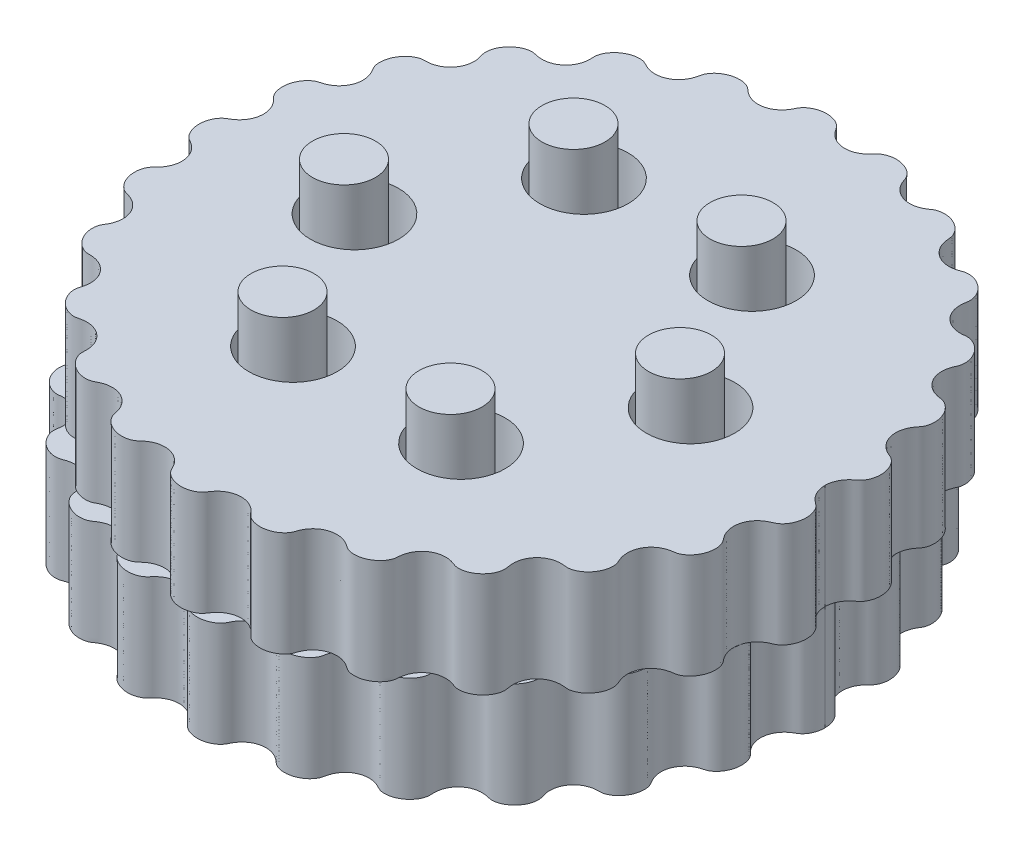
from build123d import *

# Parameters (mm, degrees)
ROTOR1_DEPTH               = 5
ROTOR2_DEPTH               = 5
SKETCH5_R                  = 2.1
CUT_EXTRUDE1_DEPTH         = 23.948222495
SKETCH7_R                  = 2.1
CUT_EXTRUDE2_DEPTH         = 23.948222495
BOSS_EXTRUDE3_DEPTH        = 7
BOSS_EXTRUDE3_DEPTH_BACK   = 7
SKETCH8_R                  = 1.5
BOSS_EXTRUDE3_2_DEPTH      = 7
BOSS_EXTRUDE3_2_DEPTH_BACK = 7
BOSS_EXTRUDE3_3_DEPTH      = 7
BOSS_EXTRUDE3_3_DEPTH_BACK = 7
BOSS_EXTRUDE3_4_DEPTH      = 7
BOSS_EXTRUDE3_4_DEPTH_BACK = 7
BOSS_EXTRUDE3_5_DEPTH      = 7
BOSS_EXTRUDE3_5_DEPTH_BACK = 7
BOSS_EXTRUDE3_6_DEPTH      = 7
BOSS_EXTRUDE3_6_DEPTH_BACK = 7


with BuildPart() as part:
    # Sketch1 → Rotor1 (new body)
    with BuildSketch(Plane(origin=(0, 0, 0), x_dir=(1, 0, 0), z_dir=(0, 1, 0))):
        with BuildLine():
            add(Edge.make_bspline(
                [(14.4, -1.1e-08), (14.400000001, -0.017963894), (14.400999325, -0.054155771), (14.405496286, -0.123245553), (14.417452599, -0.20573374), (14.435300787, -0.284760877), (14.4589362, -0.363829831), (14.495530719, -0.460103308), (14.553831752, -0.577672691), (14.628963281, -0.690475207), (14.720523729, -0.795156225), (14.809877934, -0.878529691), (14.885972394, -0.939710303), (14.965266307, -0.996877199), (15.039390332, -1.060755702), (15.101813087, -1.1365269), (15.154322639, -1.219306585), (15.208602434, -1.32923281), (15.256294513, -1.468797209), (15.288097057, -1.638083718), (15.294503414, -1.881017912), (15.252298042, -2.119867931), (15.163760173, -2.344380178), (15.042398535, -2.523140054), (14.942454381, -2.628650556), (14.845312007, -2.703603753), (14.757199453, -2.750371149), (14.66440863, -2.786732337), (14.573413204, -2.826965826), (14.463621968, -2.885730191), (14.308968592, -2.990239537), (14.130503911, -3.165844741), (13.972147716, -3.434992926), (13.893985816, -3.773342001), (13.916927808, -4.080338891), (13.995171309, -4.310200424), (14.082412472, -4.468541992), (14.150259613, -4.567703681), (14.210025969, -4.642870287), (14.270573808, -4.717649143), (14.32017647, -4.800200546), (14.365416943, -4.91091898), (14.399338621, -5.049561586), (14.416852384, -5.262398451), (14.384340257, -5.500937495), (14.304056201, -5.7310234), (14.177986314, -5.9417817), (14.047854527, -6.095731642), (13.910789322, -6.208565641), (13.777136929, -6.28441621), (13.654566558, -6.32593374), (13.550560114, -6.341335339), (13.446683831, -6.355615283), (13.344146077, -6.378219323), (13.218558991, -6.41641264), (13.049118162, -6.490187812), (12.850381416, -6.623876974), (12.649361866, -6.848376669), (12.506075586, -7.152262001), (12.462998655, -7.451002994), (12.489972163, -7.69205841), (12.539204894, -7.862350541), (12.580286881, -7.968000454), (12.618270058, -8.05035281), (12.654435707, -8.133644569), (12.67828402, -8.221362481), (12.69293821, -8.335981034), (12.690655932, -8.476153303), (12.654303427, -8.685493391), (12.545224093, -8.951238995), (12.373057296, -9.183722748), (12.149188736, -9.36630462), (11.953264421, -9.463318217), (11.8115865, -9.50624133), (11.686731815, -9.522483861), (11.58348893, -9.51696876), (11.48115852, -9.503432832), (11.378198871, -9.496859089), (11.274929425, -9.498212488), (11.172138668, -9.508022516), (11.008490166, -9.538189717), (10.791018295, -9.615836382), (10.543765179, -9.778692266), (10.347434116, -10.024278337), (10.240209477, -10.26860741), (10.194325995, -10.484243669), (10.185347958, -10.638429719), (10.193136925, -10.770510303), (10.209146495, -10.879533526), (10.225593522, -10.966240323), (10.235972752, -11.053921889), (10.233096637, -11.142311607), (10.215769105, -11.253426257), (10.176716121, -11.384209778), (10.088557605, -11.571773087), (9.914555383, -11.800570763), (9.643929342, -12.015790447), (9.338394122, -12.131431635), (9.092328696, -12.151919702), (8.938831739, -12.124722497), (8.874148218, -12.104917702), (8.823297107, -12.086266814), (8.760022097, -12.062210535), (8.657742826, -12.026792701), (8.51270891, -11.991319783), (8.29542858, -11.971044795), (8.023342439, -12.005783654), (7.739745801, -12.120021465), (7.477486439, -12.330308782), (7.309271559, -12.57578625), (7.227745922, -12.796401994), (7.194847937, -12.964652405), (7.183073646, -13.07292309), (7.177410404, -13.159952295), (7.163856376, -13.268191841), (7.12074447, -13.396146666), (7.04321196, -13.535732382), (6.89627577, -13.715388868), (6.667818125, -13.896296536), (6.347779256, -14.038713443), (6.019985381, -14.072734153), (5.761855417, -14.026890176), (5.598538329, -13.943823739), (5.512636752, -13.880075487), (5.401773469, -13.805681452), (5.259871996, -13.730304634), (5.052431683, -13.656485775), (4.773827305, -13.622953687), (4.46255928, -13.668320782), (4.188839227, -13.799904644), (3.99115524, -13.966548431), (3.857834156, -14.133926056), (3.782595533, -14.263163453), (3.73089554, -14.379947148), (3.695923656, -14.480038165), (3.668903575, -14.56056126), (3.62507674, -14.657311096), (3.549396273, -14.764707443), (3.439982877, -14.875186912), (3.255657935, -15.00602338), (2.992827005, -15.120144401), (2.65146927, -15.175703985), (2.340640845, -15.129056629), (2.125825026, -15.033765606), (2.01095249, -14.946775166), (1.969759765, -14.909017829), (1.931739421, -14.868053089), (1.895416305, -14.825543555), (1.849863454, -14.77258461), (1.77347621, -14.69102442), (1.657607631, -14.589330165), (1.467716596, -14.468702735), (1.201270643, -14.374830021), (0.894276464, -14.351781734), (0.570473057, -14.423577184), (0.317305808, -14.563244657), (0.151544535, -14.714094634), (0.048135537, -14.841768922), (-0.011407191, -14.928873374), (-0.056990802, -15.000049905), (-0.120513174, -15.084517519), (-0.216680297, -15.171117797), (-0.34549143, -15.252082711), (-0.54837758, -15.335584829), (-0.812768135, -15.385413023), (-1.08398033, -15.372591601), (-1.344979396, -15.297228844), (-1.543453254, -15.192188591), (-1.665764515, -15.097631883), (-1.754670111, -15.002005217), (-1.811224291, -14.912766064), (-1.84828467, -14.836853427), (-1.894839843, -14.742230931), (-1.981132624, -14.596441274), (-2.130461194, -14.415292399), (-2.371747297, -14.237403554), (-2.694146309, -14.124304399), (-3.005807455, -14.112082948), (-3.279802462, -14.174238248), (-3.481365688, -14.271328999), (-3.60773786, -14.358112928), (-3.692850373, -14.429558259), (-3.74427353, -14.476277738), (-3.785484156, -14.513603407), (-3.839036845, -14.557816708), (-3.971847627, -14.642561642), (-4.20921174, -14.716336781), (-4.537869776, -14.723206433), (-4.870972811, -14.623310282), (-5.119164279, -14.474114092), (-5.287202463, -14.31612828), (-5.381818938, -14.188749792), (-5.441586375, -14.068625268), (-5.46975415, -13.963937183), (-5.486204905, -13.878819004), (-5.510615327, -13.773376574), (-5.562785616, -13.611202262), (-5.668639833, -13.402851094), (-5.861501447, -13.180791), (-6.140857637, -13.003605734), (-6.432388767, -12.920479541), (-6.707046809, -12.913935909), (-6.924587142, -12.957968989), (-7.07050238, -13.011926964), (-7.171892452, -13.061227322), (-7.234172284, -13.094294359), (-7.284238063, -13.120336712), (-7.348454275, -13.149383063), (-7.450392674, -13.181305856), (-7.592859889, -13.199325129), (-7.822504161, -13.187514007), (-8.108178972, -13.101882305), (-8.360699787, -12.94808201), (-8.564054354, -12.739257859), (-8.686860146, -12.541025873), (-8.74585884, -12.391334007), (-8.771139209, -12.257945407), (-8.769723405, -12.148158808), (-8.76448864, -12.060600001), (-8.76328367, -11.951025213), (-8.773134312, -11.82121231), (-8.80185927, -11.673189798), (-8.872937495, -11.471740575), (-9.004528382, -11.249998927), (-9.220498075, -11.035106921), (-9.499737861, -10.890462164), (-9.747533575, -10.836885182), (-9.938296039, -10.832213385), (-10.067515159, -10.843724441), (-10.169837402, -10.860857799), (-10.270401277, -10.885915811), (-10.371724825, -10.908895631), (-10.499540752, -10.914403334), (-10.649899337, -10.893032288), (-10.864421966, -10.823595689), (-11.115446859, -10.670179726), (-11.318488225, -10.460805422), (-11.461426574, -10.211875584), (-11.524752828, -10.01339185), (-11.546391783, -9.877677893), (-11.548709946, -9.764594057), (-11.539339964, -9.676135035), (-11.516898431, -9.590207141), (-11.489593176, -9.505764669), (-11.460576483, -9.39879123), (-11.437115987, -9.267755201), (-11.428038548, -9.112624279), (-11.448899374, -8.891732592), (-11.525306454, -8.644379141), (-11.680559893, -8.391694512), (-11.908335055, -8.1892927), (-12.146089604, -8.066431986), (-12.351540814, -8.011178606), (-12.509041199, -7.991839863), (-12.640826604, -7.989460905), (-12.746563923, -7.988166594), (-12.874375664, -7.963828284), (-13.017764419, -7.905880158), (-13.169249054, -7.811412184), (-13.319017911, -7.67467483), (-13.471981566, -7.480515093), (-13.581458721, -7.26088384), (-13.644013329, -7.026575527), (-13.652860983, -6.812940158), (-13.636539268, -6.672850547), (-13.606445611, -6.560514458), (-13.570431248, -6.47644639), (-13.523166045, -6.398237921), (-13.475169498, -6.320638215), (-13.421523123, -6.219949083), (-13.352206533, -6.055609876), (-13.297223226, -5.817805919), (-13.306144027, -5.511232057), (-13.418270878, -5.185792715), (-13.599550751, -4.937285866), (-13.788421733, -4.782570887), (-13.950444377, -4.693122875), (-14.06801063, -4.644081777), (-14.164678268, -4.612081771), (-14.263358787, -4.586968674), (-14.360622663, -4.556204), (-14.472064557, -4.497213616), (-14.590574842, -4.40538808), (-14.741515667, -4.240877039), (-14.885567754, -3.984040211), (-14.960547294, -3.700013764), (-14.962476998, -3.409357191), (-14.917122591, -3.199365314), (-14.864866179, -3.065550719), (-14.804762459, -2.961268161), (-14.743749576, -2.885986018), (-14.673498586, -2.819366418), (-14.604759941, -2.751454392), (-14.541077466, -2.678635477), (-14.482882337, -2.601336735), (-14.398435049, -2.468448884), (-14.309915908, -2.267781913), (-14.257239562, -1.991630404), (-14.294765453, -1.652711362), (-14.415656628, -1.372497371), (-14.564768485, -1.180602711), (-14.700945682, -1.058517568), (-14.801501658, -0.985661301), (-14.885953438, -0.933566063), (-14.97324049, -0.886147055), (-15.055953156, -0.830915631), (-15.145345985, -0.745702812), (-15.234104562, -0.627876898), (-15.302099632, -0.497917175), (-15.350570864, -0.359469707), (-15.378415705, -0.242180773), (-15.393222629, -0.147288369), (-15.398767774, -0.063519122), (-15.399999999, -0.02121356), (-15.4, -1.249e-06)],
                knots=[0.062565796, 0.062565796, 0.062565796, 0.062565796, 0.062565796, 0.063859973, 0.06515415, 0.066448326, 0.067742503, 0.06903668, 0.070330857, 0.07291921, 0.075992333, 0.077528894, 0.079065456, 0.080602017, 0.082138578, 0.08367514, 0.085211701, 0.086753761, 0.088295822, 0.091379943, 0.094464064, 0.097548185, 0.103528845, 0.106519174, 0.109509504, 0.111075374, 0.112641243, 0.114207112, 0.115772981, 0.117338851, 0.11890472, 0.122036458, 0.127492162, 0.132947866, 0.138255082, 0.143562297, 0.146585003, 0.148096356, 0.149607709, 0.151119061, 0.152630414, 0.154141767, 0.15565312, 0.158617995, 0.161582869, 0.167512619, 0.170668106, 0.173823593, 0.17697908, 0.180134567, 0.181785014, 0.183435461, 0.185085908, 0.186736355, 0.188386802, 0.190037249, 0.193338142, 0.198333612, 0.203329082, 0.208757311, 0.21418554, 0.217038738, 0.218465337, 0.219891935, 0.221318534, 0.222745133, 0.224171732, 0.225598331, 0.22856804, 0.23153775, 0.237477169, 0.243508984, 0.246524892, 0.2495408, 0.251163787, 0.252786774, 0.254409762, 0.256032749, 0.257655736, 0.259278723, 0.26090171, 0.262524697, 0.268116353, 0.273708009, 0.279232337, 0.2819945, 0.284756664, 0.287531357, 0.288918704, 0.290306051, 0.291693397, 0.293080744, 0.294468091, 0.295855437, 0.298751953, 0.301648468, 0.307441499, 0.313806246, 0.320170993, 0.321874543, 0.322726318, 0.323578093, 0.324429868, 0.325281643, 0.326985192, 0.330392292, 0.333799391, 0.338941908, 0.344084424, 0.349371027, 0.354657629, 0.357399899, 0.358771034, 0.360142168, 0.361513303, 0.362884438, 0.365626708, 0.368571539, 0.37151637, 0.377406032, 0.383827609, 0.390249186, 0.391929851, 0.393610516, 0.39529118, 0.396971845, 0.400333174, 0.403694503, 0.409075747, 0.41445699, 0.419832854, 0.422520785, 0.425208717, 0.427878342, 0.429213155, 0.430547968, 0.431882781, 0.433217593, 0.435887219, 0.438758038, 0.441628857, 0.447370496, 0.453780785, 0.460191075, 0.461070296, 0.461949517, 0.462828738, 0.463707959, 0.46458718, 0.465466401, 0.467224842, 0.470741726, 0.47425861, 0.479541903, 0.484825197, 0.489835983, 0.494846769, 0.497503724, 0.498832202, 0.500160679, 0.501489157, 0.502817634, 0.505474589, 0.508247059, 0.511019529, 0.516564468, 0.52227034, 0.525123276, 0.527976212, 0.530631288, 0.531958826, 0.533286364, 0.534613902, 0.53594144, 0.538596516, 0.543936045, 0.549275574, 0.554531257, 0.559786941, 0.563284399, 0.566781857, 0.568530587, 0.569404951, 0.570279316, 0.57115368, 0.572028045, 0.573776774, 0.580152949, 0.586529123, 0.592383377, 0.595310504, 0.598237631, 0.600962992, 0.602325673, 0.603688354, 0.605051034, 0.606413715, 0.609139076, 0.614392618, 0.619646159, 0.624660447, 0.629674735, 0.633223523, 0.636772312, 0.638546707, 0.639433904, 0.640321101, 0.641208298, 0.642095495, 0.64386989, 0.647025799, 0.650181709, 0.656493529, 0.662419511, 0.665382503, 0.668345494, 0.671104535, 0.672484055, 0.673863575, 0.675243096, 0.676622616, 0.679381657, 0.682041398, 0.68470114, 0.690020622, 0.695473381, 0.700926139, 0.704188253, 0.70581931, 0.707450368, 0.709081425, 0.710712482, 0.712343539, 0.713974596, 0.717095441, 0.720216286, 0.726457975, 0.732286917, 0.735201388, 0.738115858, 0.739511278, 0.740906697, 0.742302116, 0.743697535, 0.745092954, 0.746488373, 0.749279211, 0.752059022, 0.754838832, 0.760398454, 0.765423781, 0.770449108, 0.773768675, 0.777088241, 0.778748025, 0.780407808, 0.782067591, 0.783727374, 0.786901153, 0.790074931, 0.793248709, 0.796422487, 0.802397424, 0.805384893, 0.808372361, 0.809807963, 0.811243566, 0.812679168, 0.81411477, 0.815550372, 0.816985974, 0.819857178, 0.825317904, 0.830778629, 0.835989797, 0.841200965, 0.844404173, 0.846005778, 0.847607382, 0.849208986, 0.85081059, 0.852412194, 0.854013798, 0.857107086, 0.860200373, 0.866386948, 0.872352981, 0.875335998, 0.878319014, 0.879839881, 0.881360748, 0.882881615, 0.884402482, 0.885923349, 0.887444216, 0.888965083, 0.890485949, 0.895823145, 0.90116034, 0.906397405, 0.911634469, 0.914757263, 0.91631866, 0.917880057, 0.919441454, 0.921002851, 0.922564248, 0.924125645, 0.927182053, 0.930238461, 0.931766665, 0.933294869, 0.934823073, 0.936351301, 0.936351301, 0.936351301, 0.936351301, 0.936351301], degree=4))
            add(Edge.make_bspline(
                [(14.4, -1.1e-08), (14.4, 0.017963987), (14.400999323, 0.054155864), (14.405496281, 0.123245646), (14.417452591, 0.205733834), (14.435300775, 0.284760971), (14.458936185, 0.363829927), (14.4955307, 0.460103405), (14.553831728, 0.577672791), (14.628963253, 0.690475309), (14.720523696, 0.795156331), (14.809877897, 0.878529801), (14.885972355, 0.939710416), (14.965266265, 0.996877315), (15.039390288, 1.060755822), (15.10181304, 1.136527022), (15.154322588, 1.219306709), (15.208602379, 1.329232937), (15.256294452, 1.468797337), (15.288096989, 1.638083848), (15.294503336, 1.881018042), (15.252297954, 2.119868059), (15.163760076, 2.344380303), (15.042398431, 2.523140174), (14.942454271, 2.628650672), (14.845311894, 2.703603864), (14.757199339, 2.750371256), (14.664408514, 2.786732441), (14.573413087, 2.826965926), (14.463621848, 2.885730286), (14.308968467, 2.990239626), (14.130503779, 3.165844823), (13.972147573, 3.434993001), (13.893985659, 3.773342073), (13.916927638, 4.080338964), (13.99517113, 4.310200501), (14.082412286, 4.468542072), (14.150259423, 4.567703763), (14.210025776, 4.642870373), (14.270573611, 4.71764923), (14.32017627, 4.800200636), (14.365416739, 4.910919071), (14.399338411, 5.049561679), (14.416852165, 5.262398545), (14.384340028, 5.500937587), (14.304055963, 5.731023489), (14.177986067, 5.941781784), (14.047854273, 6.09573172), (13.910789064, 6.208565714), (13.777136668, 6.284416277), (13.654566295, 6.325933802), (13.550559851, 6.341335397), (13.446683566, 6.355615337), (13.344145812, 6.378219372), (13.218558725, 6.416412684), (13.049117892, 6.490187849), (12.850381141, 6.623877003), (12.649361581, 6.84837669), (12.506075288, 7.152262016), (12.462998345, 7.451003007), (12.489971843, 7.692058424), (12.539204567, 7.862350557), (12.58028655, 7.968000472), (12.618269724, 8.050352829), (12.654435369, 8.13364459), (12.678283679, 8.221362503), (12.692937864, 8.335981056), (12.690655579, 8.476153325), (12.654303066, 8.685493412), (12.545223721, 8.951239011), (12.373056915, 9.183722757), (12.149188347, 9.36630462), (11.953264028, 9.463318208), (11.811586105, 9.506241315), (11.68673142, 9.522483842), (11.583488535, 9.516968736), (11.481158125, 9.503432803), (11.378198476, 9.496859057), (11.27492903, 9.498212452), (11.172138272, 9.508022475), (11.00848977, 9.538189669), (10.791017895, 9.615836325), (10.543764772, 9.778692199), (10.347433699, 10.024278261), (10.24020905, 10.26860733), (10.194325559, 10.484243587), (10.185347516, 10.638429637), (10.193136478, 10.770510221), (10.209146043, 10.879533445), (10.225593066, 10.966240242), (10.235972292, 11.053921809), (10.233096174, 11.142311527), (10.215768637, 11.253426176), (10.176715648, 11.384209695), (10.088557124, 11.571773001), (9.914554892, 11.800570669), (9.643928842, 12.015790342), (9.338393618, 12.131431518), (9.092328191, 12.151919575), (8.938831235, 12.124722364), (8.874147714, 12.104917565), (8.823296604, 12.086266676), (8.760021595, 12.062210394), (8.657742326, 12.026792556), (8.512708411, 11.991319631), (8.295428082, 11.971044634), (8.02334194, 12.005783482), (7.739745297, 12.120021281), (7.477485926, 12.330308588), (7.309271036, 12.575786049), (7.227745391, 12.796401789), (7.194847398, 12.964652198), (7.183073102, 13.072922883), (7.177409857, 13.159952088), (7.163855825, 13.268191633), (7.120743913, 13.396146456), (7.043211398, 13.535732169), (6.8962752, 13.715388649), (6.667817547, 13.896296307), (6.347778672, 14.038713201), (6.019984796, 14.072733898), (5.761854834, 14.02688991), (5.59853775, 13.943823467), (5.512636175, 13.88007521), (5.401772895, 13.805681171), (5.259871426, 13.730304348), (5.052431116, 13.656485479), (4.773826739, 13.62295338), (4.462558712, 13.668320463), (4.188838653, 13.799904313), (3.991154659, 13.966548092), (3.857833569, 14.133925711), (3.78259494, 14.263163104), (3.730894943, 14.379946797), (3.695923054, 14.480037814), (3.66890297, 14.560560907), (3.625076131, 14.657310741), (3.549395659, 14.764707085), (3.439982259, 14.87518655), (3.255657311, 15.00602301), (2.992826376, 15.12014402), (2.651468639, 15.175703589), (2.340640217, 15.129056221), (2.125824401, 15.033765188), (2.010951868, 14.946774745), (1.969759145, 14.909017405), (1.931738803, 14.868052664), (1.895415689, 14.825543128), (1.84986284, 14.772584182), (1.773475599, 14.691023988), (1.657607025, 14.589329728), (1.467715995, 14.468702291), (1.201270045, 14.374829566), (0.894275868, 14.351781266), (0.570472458, 14.423576702), (0.317305203, 14.563244165), (0.151543923, 14.714094135), (0.04813492, 14.841768418), (-0.011407811, 14.928872868), (-0.056991425, 15.000049398), (-0.120513801, 15.084517008), (-0.216680927, 15.171117283), (-0.345492063, 15.252082191), (-0.548378217, 15.335584301), (-0.812768774, 15.385412484), (-1.083980969, 15.372591051), (-1.344980032, 15.297228283), (-1.543453885, 15.192188022), (-1.665765143, 15.097631308), (-1.754670735, 15.002004639), (-1.81122491, 14.912765484), (-1.848285287, 14.836852845), (-1.894840456, 14.742230347), (-1.98113323, 14.596440686), (-2.130461793, 14.415291805), (-2.371747889, 14.23740295), (-2.694146896, 14.124303782), (-3.005808041, 14.112082318), (-3.279803051, 14.174237606), (-3.481366281, 14.271328349), (-3.607738457, 14.358112273), (-3.692850973, 14.4295576), (-3.744274132, 14.476277077), (-3.785484759, 14.513602744), (-3.83903745, 14.557816043), (-3.971848236, 14.642560972), (-4.209212351, 14.716336101), (-4.537870388, 14.723205739), (-4.870973419, 14.623309574), (-5.11916488, 14.474113373), (-5.287203058, 14.316127554), (-5.381819528, 14.188749063), (-5.44158696, 14.068624536), (-5.46975473, 13.96393645), (-5.486205481, 13.878818271), (-5.510615899, 13.773375839), (-5.562786182, 13.611201525), (-5.66864039, 13.402850352), (-5.861501995, 13.18079025), (-6.140858177, 13.003604973), (-6.432389304, 12.920478768), (-6.707047346, 12.913935125), (-6.924587681, 12.957968196), (-7.070502921, 13.011926165), (-7.171892995, 13.061226518), (-7.234172828, 13.094293553), (-7.284238608, 13.120335903), (-7.348454821, 13.149382252), (-7.450393222, 13.181305041), (-7.592860438, 13.199324308), (-7.822504709, 13.187513176), (-8.108179517, 13.101881463), (-8.360700325, 12.948081157), (-8.564054883, 12.739256997), (-8.686860667, 12.541025006), (-8.745859355, 12.391333138), (-8.771139719, 12.257944537), (-8.76972391, 12.148157938), (-8.764489142, 12.060599131), (-8.763284167, 11.951024344), (-8.773134803, 11.82121144), (-8.801859755, 11.673188927), (-8.872937972, 11.4717397), (-9.004528849, 11.249998047), (-9.220498534, 11.035106033), (-9.499738314, 10.890461263), (-9.747534026, 10.836884271), (-9.93829649, 10.832212466), (-10.067515609, 10.843723517), (-10.169837853, 10.860856871), (-10.27040173, 10.885914879), (-10.371725278, 10.908894695), (-10.499541206, 10.914402392), (-10.649899789, 10.89303134), (-10.864422416, 10.823594732), (-11.115447303, 10.670178758), (-11.31848866, 10.460804446), (-11.461426998, 10.211874603), (-11.524753245, 10.013390865), (-11.546392194, 9.877676908), (-11.548710352, 9.764593071), (-11.539340366, 9.67613405), (-11.516898829, 9.590206157), (-11.489593571, 9.505763686), (-11.460576873, 9.398790248), (-11.437116372, 9.26775422), (-11.428038926, 9.112623299), (-11.448899743, 8.891731611), (-11.525306813, 8.644378157), (-11.680560241, 8.391693521), (-11.908335396, 8.1892917), (-12.146089939, 8.066430976), (-12.351541147, 8.011177587), (-12.509041531, 7.991838838), (-12.640826936, 7.989459874), (-12.746564255, 7.988165559), (-12.874375995, 7.963827243), (-13.017764748, 7.905879111), (-13.169249379, 7.811411131), (-13.319018229, 7.674673771), (-13.471981877, 7.480514028), (-13.581459023, 7.26088277), (-13.644013621, 7.026574455), (-13.652861266, 6.812939085), (-13.636539546, 6.672849474), (-13.606445884, 6.560513387), (-13.570431517, 6.47644532), (-13.523166311, 6.398236853), (-13.47516976, 6.320637149), (-13.421523381, 6.21994802), (-13.352206784, 6.055608816), (-13.297223468, 5.817804861), (-13.306144256, 5.511230999), (-13.418271093, 5.185791652), (-13.599550957, 4.937284795), (-13.788421932, 4.782569808), (-13.950444572, 4.69312179), (-14.068010823, 4.644080687), (-14.16467846, 4.612080677), (-14.263358978, 4.586967575), (-14.360622852, 4.556202898), (-14.472064743, 4.497212509), (-14.590575025, 4.405386968), (-14.741515844, 4.240875921), (-14.885567919, 3.984039087), (-14.960547448, 3.700012637), (-14.96247714, 3.409356064), (-14.917122724, 3.199364189), (-14.864866306, 3.065549595), (-14.804762583, 2.96126704), (-14.743749696, 2.8859849), (-14.673498703, 2.819365303), (-14.604760055, 2.751453279), (-14.541077577, 2.678634367), (-14.482882445, 2.601335627), (-14.398435152, 2.46844778), (-14.309916002, 2.267780812), (-14.257239645, 1.991629306), (-14.294765521, 1.652710263), (-14.415656685, 1.372496266), (-14.564768534, 1.1806016), (-14.700945726, 1.058516451), (-14.801501699, 0.985660181), (-14.885953477, 0.933564939), (-14.973240527, 0.886145928), (-15.055953191, 0.8309145), (-15.145346016, 0.745701677), (-15.234104589, 0.62787576), (-15.302099652, 0.497916033), (-15.350570879, 0.359468564), (-15.378415715, 0.242179629), (-15.393222635, 0.147287224), (-15.398767777, 0.063517977), (-15.4, 0.021212414), (-15.4, -1.249e-06)],
                knots=[0.062565796, 0.062565796, 0.062565796, 0.062565796, 0.062565796, 0.063859973, 0.06515415, 0.066448326, 0.067742503, 0.06903668, 0.070330857, 0.07291921, 0.075992333, 0.077528894, 0.079065456, 0.080602017, 0.082138578, 0.08367514, 0.085211701, 0.086753761, 0.088295822, 0.091379943, 0.094464064, 0.097548185, 0.103528845, 0.106519174, 0.109509504, 0.111075374, 0.112641243, 0.114207112, 0.115772981, 0.117338851, 0.11890472, 0.122036458, 0.127492162, 0.132947866, 0.138255082, 0.143562297, 0.146585003, 0.148096356, 0.149607709, 0.151119061, 0.152630414, 0.154141767, 0.15565312, 0.158617995, 0.161582869, 0.167512619, 0.170668106, 0.173823593, 0.17697908, 0.180134567, 0.181785014, 0.183435461, 0.185085908, 0.186736355, 0.188386802, 0.190037249, 0.193338142, 0.198333612, 0.203329082, 0.208757311, 0.21418554, 0.217038738, 0.218465337, 0.219891935, 0.221318534, 0.222745133, 0.224171732, 0.225598331, 0.22856804, 0.23153775, 0.237477169, 0.243508984, 0.246524892, 0.2495408, 0.251163787, 0.252786774, 0.254409762, 0.256032749, 0.257655736, 0.259278723, 0.26090171, 0.262524697, 0.268116353, 0.273708009, 0.279232337, 0.2819945, 0.284756664, 0.287531357, 0.288918704, 0.290306051, 0.291693397, 0.293080744, 0.294468091, 0.295855437, 0.298751953, 0.301648468, 0.307441499, 0.313806246, 0.320170993, 0.321874543, 0.322726318, 0.323578093, 0.324429868, 0.325281643, 0.326985192, 0.330392292, 0.333799391, 0.338941908, 0.344084424, 0.349371027, 0.354657629, 0.357399899, 0.358771034, 0.360142168, 0.361513303, 0.362884438, 0.365626708, 0.368571539, 0.37151637, 0.377406032, 0.383827609, 0.390249186, 0.391929851, 0.393610516, 0.39529118, 0.396971845, 0.400333174, 0.403694503, 0.409075747, 0.41445699, 0.419832854, 0.422520785, 0.425208717, 0.427878342, 0.429213155, 0.430547968, 0.431882781, 0.433217593, 0.435887219, 0.438758038, 0.441628857, 0.447370496, 0.453780785, 0.460191075, 0.461070296, 0.461949517, 0.462828738, 0.463707959, 0.46458718, 0.465466401, 0.467224842, 0.470741726, 0.47425861, 0.479541903, 0.484825197, 0.489835983, 0.494846769, 0.497503724, 0.498832202, 0.500160679, 0.501489157, 0.502817634, 0.505474589, 0.508247059, 0.511019529, 0.516564468, 0.52227034, 0.525123276, 0.527976212, 0.530631288, 0.531958826, 0.533286364, 0.534613902, 0.53594144, 0.538596516, 0.543936045, 0.549275574, 0.554531257, 0.559786941, 0.563284399, 0.566781857, 0.568530587, 0.569404951, 0.570279316, 0.57115368, 0.572028045, 0.573776774, 0.580152949, 0.586529123, 0.592383377, 0.595310504, 0.598237631, 0.600962992, 0.602325673, 0.603688354, 0.605051034, 0.606413715, 0.609139076, 0.614392618, 0.619646159, 0.624660447, 0.629674735, 0.633223523, 0.636772312, 0.638546707, 0.639433904, 0.640321101, 0.641208298, 0.642095495, 0.64386989, 0.647025799, 0.650181709, 0.656493529, 0.662419511, 0.665382503, 0.668345494, 0.671104535, 0.672484055, 0.673863575, 0.675243096, 0.676622616, 0.679381657, 0.682041398, 0.68470114, 0.690020622, 0.695473381, 0.700926139, 0.704188253, 0.70581931, 0.707450368, 0.709081425, 0.710712482, 0.712343539, 0.713974596, 0.717095441, 0.720216286, 0.726457975, 0.732286917, 0.735201388, 0.738115858, 0.739511278, 0.740906697, 0.742302116, 0.743697535, 0.745092954, 0.746488373, 0.749279211, 0.752059022, 0.754838832, 0.760398454, 0.765423781, 0.770449108, 0.773768675, 0.777088241, 0.778748025, 0.780407808, 0.782067591, 0.783727374, 0.786901153, 0.790074931, 0.793248709, 0.796422487, 0.802397424, 0.805384893, 0.808372361, 0.809807963, 0.811243566, 0.812679168, 0.81411477, 0.815550372, 0.816985974, 0.819857178, 0.825317904, 0.830778629, 0.835989797, 0.841200965, 0.844404173, 0.846005778, 0.847607382, 0.849208986, 0.85081059, 0.852412194, 0.854013798, 0.857107086, 0.860200373, 0.866386948, 0.872352981, 0.875335998, 0.878319014, 0.879839881, 0.881360748, 0.882881615, 0.884402482, 0.885923349, 0.887444216, 0.888965083, 0.890485949, 0.895823145, 0.90116034, 0.906397405, 0.911634469, 0.914757263, 0.91631866, 0.917880057, 0.919441454, 0.921002851, 0.922564248, 0.924125645, 0.927182053, 0.930238461, 0.931766665, 0.933294869, 0.934823073, 0.936351277, 0.936351277, 0.936351277, 0.936351277, 0.936351277], degree=4))
        make_face()
    extrude(amount=ROTOR1_DEPTH)

    # Sketch3 → Rotor2 (add)
    with BuildSketch(Plane(origin=(0, 0, 0), x_dir=(1, 0, 0), z_dir=(0, 1, 0))):
        with BuildLine():
            add(Edge.make_bspline(
                [(-15.4, -5e-09), (-15.4, -0.017963888), (-15.400999323, -0.054155765), (-15.405496281, -0.123245547), (-15.417452591, -0.205733735), (-15.435300776, -0.284760873), (-15.458936185, -0.363829828), (-15.4955307, -0.460103306), (-15.553831728, -0.577672692), (-15.628963253, -0.69047521), (-15.720523696, -0.795156232), (-15.809877897, -0.878529703), (-15.885972355, -0.939710317), (-15.965266265, -0.996877217), (-16.039390288, -1.060755723), (-16.10181304, -1.136526924), (-16.154322588, -1.219306611), (-16.208602379, -1.329232838), (-16.256294452, -1.468797238), (-16.288096989, -1.638083749), (-16.294503336, -1.881017943), (-16.252297954, -2.119867961), (-16.163760076, -2.344380204), (-16.042398431, -2.523140075), (-15.942454271, -2.628650573), (-15.845311894, -2.703603766), (-15.757199339, -2.750371158), (-15.664408514, -2.786732343), (-15.573413087, -2.826965828), (-15.463621848, -2.885730188), (-15.308968468, -2.990239528), (-15.130503779, -3.165844724), (-14.972147574, -3.434992903), (-14.893985659, -3.773341974), (-14.916927638, -4.080338866), (-14.99517113, -4.310200402), (-15.082412287, -4.468541973), (-15.150259423, -4.567703664), (-15.210025776, -4.642870274), (-15.270573612, -4.717649132), (-15.32017627, -4.800200537), (-15.365416739, -4.910918973), (-15.399338412, -5.04956158), (-15.416852165, -5.262398446), (-15.384340028, -5.500937488), (-15.304055963, -5.73102339), (-15.177986067, -5.941781686), (-15.047854273, -6.095731621), (-14.910789064, -6.208565615), (-14.777136668, -6.284416179), (-14.654566295, -6.325933703), (-14.550559851, -6.341335298), (-14.446683567, -6.355615238), (-14.344145812, -6.378219273), (-14.218558725, -6.416412585), (-14.049117893, -6.49018775), (-13.850381141, -6.623876904), (-13.649361581, -6.848376591), (-13.506075289, -7.152261917), (-13.462998345, -7.451002908), (-13.489971843, -7.692058325), (-13.539204567, -7.862350458), (-13.58028655, -7.968000373), (-13.618269724, -8.05035273), (-13.654435369, -8.133644491), (-13.678283679, -8.221362404), (-13.692937864, -8.335980957), (-13.690655579, -8.476153226), (-13.654303066, -8.685493313), (-13.545223721, -8.951238912), (-13.373056915, -9.183722658), (-13.149188347, -9.366304521), (-12.953264028, -9.463318109), (-12.811586105, -9.506241216), (-12.68673142, -9.522483743), (-12.583488535, -9.516968637), (-12.481158125, -9.503432705), (-12.378198476, -9.496858958), (-12.27492903, -9.498212353), (-12.172138273, -9.508022377), (-12.00848977, -9.53818957), (-11.791017895, -9.615836226), (-11.543764772, -9.7786921), (-11.347433699, -10.024278163), (-11.24020905, -10.268607231), (-11.19432556, -10.484243488), (-11.185347516, -10.638429538), (-11.193136478, -10.770510123), (-11.209146043, -10.879533346), (-11.225593066, -10.966240143), (-11.235972293, -11.05392171), (-11.233096174, -11.142311428), (-11.215768637, -11.253426077), (-11.176715648, -11.384209597), (-11.088557124, -11.571772902), (-10.914554892, -11.80057057), (-10.643928842, -12.015790244), (-10.338393618, -12.131431419), (-10.092328192, -12.151919476), (-9.938831235, -12.124722265), (-9.874147715, -12.104917467), (-9.823296604, -12.086266577), (-9.760021595, -12.062210295), (-9.657742326, -12.026792457), (-9.512708412, -11.991319533), (-9.295428082, -11.971044536), (-9.02334194, -12.005783383), (-8.739745297, -12.120021182), (-8.477485926, -12.330308489), (-8.309271036, -12.57578595), (-8.227745391, -12.79640169), (-8.194847398, -12.964652099), (-8.183073102, -13.072922784), (-8.177409858, -13.159951989), (-8.163855825, -13.268191535), (-8.120743914, -13.396146358), (-8.043211398, -13.53573207), (-7.896275201, -13.71538855), (-7.667817547, -13.896296209), (-7.347778673, -14.038713103), (-7.019984797, -14.072733799), (-6.761854834, -14.026889811), (-6.59853775, -13.943823368), (-6.512636175, -13.880075112), (-6.401772895, -13.805681073), (-6.259871426, -13.730304249), (-6.052431116, -13.65648538), (-5.773826739, -13.622953281), (-5.462558712, -13.668320364), (-5.188838654, -13.799904214), (-4.991154659, -13.966547993), (-4.857833569, -14.133925612), (-4.782594941, -14.263163006), (-4.730894943, -14.379946699), (-4.695923054, -14.480037715), (-4.66890297, -14.560560808), (-4.625076131, -14.657310643), (-4.54939566, -14.764706987), (-4.439982259, -14.875186451), (-4.255657312, -15.006022911), (-3.992826377, -15.120143921), (-3.651468639, -15.175703491), (-3.340640217, -15.129056122), (-3.125824401, -15.03376509), (-3.010951868, -14.946774646), (-2.969759145, -14.909017307), (-2.931738803, -14.868052565), (-2.895415689, -14.825543029), (-2.84986284, -14.772584083), (-2.7734756, -14.691023889), (-2.657607025, -14.58932963), (-2.467715995, -14.468702192), (-2.201270046, -14.374829467), (-1.894275868, -14.351781167), (-1.570472458, -14.423576604), (-1.317305203, -14.563244066), (-1.151543923, -14.714094036), (-1.04813492, -14.84176832), (-0.988592189, -14.92887277), (-0.943008575, -15.000049299), (-0.879486199, -15.084516909), (-0.783319073, -15.171117184), (-0.654507937, -15.252082092), (-0.451621783, -15.335584202), (-0.187231226, -15.385412385), (0.083980968, -15.372590952), (0.344980032, -15.297228184), (0.543453885, -15.192187923), (0.665765143, -15.097631209), (0.754670734, -15.00200454), (0.81122491, -14.912765385), (0.848285287, -14.836852746), (0.894840455, -14.742230248), (0.98113323, -14.596440588), (1.130461793, -14.415291706), (1.371747889, -14.237402851), (1.694146895, -14.124303683), (2.005808041, -14.112082219), (2.279803051, -14.174237507), (2.481366281, -14.27132825), (2.607738457, -14.358112174), (2.692850973, -14.429557501), (2.744274132, -14.476276979), (2.785484759, -14.513602646), (2.83903745, -14.557815944), (2.971848236, -14.642560873), (3.209212351, -14.716336002), (3.537870388, -14.72320564), (3.870973419, -14.623309475), (4.11916488, -14.474113275), (4.287203057, -14.316127456), (4.381819528, -14.188748965), (4.44158696, -14.068624437), (4.46975473, -13.963936351), (4.486205481, -13.878818172), (4.510615899, -13.77337574), (4.562786182, -13.611201426), (4.66864039, -13.402850254), (4.861501994, -13.180790152), (5.140858177, -13.003604874), (5.432389304, -12.920478669), (5.707047345, -12.913935027), (5.924587681, -12.957968097), (6.070502921, -13.011926066), (6.171892994, -13.061226419), (6.234172828, -13.094293454), (6.284238608, -13.120335805), (6.348454821, -13.149382153), (6.450393222, -13.181304942), (6.592860438, -13.199324209), (6.822504709, -13.187513078), (7.108179517, -13.101881364), (7.360700325, -12.948081058), (7.564054883, -12.739256899), (7.686860667, -12.541024908), (7.745859355, -12.391333039), (7.771139719, -12.257944439), (7.769723909, -12.148157839), (7.764489141, -12.060599032), (7.763284167, -11.951024245), (7.773134803, -11.821211342), (7.801859755, -11.673188828), (7.872937972, -11.471739602), (8.004528849, -11.249997949), (8.220498534, -11.035105934), (8.499738314, -10.890461165), (8.747534026, -10.836884172), (8.938296489, -10.832212367), (9.067515609, -10.843723419), (9.169837853, -10.860856772), (9.270401729, -10.88591478), (9.371725278, -10.908894596), (9.499541205, -10.914402294), (9.649899789, -10.893031242), (9.864422416, -10.823594633), (10.115447302, -10.67017866), (10.318488659, -10.460804347), (10.461426998, -10.211874504), (10.524753244, -10.013390767), (10.546392194, -9.877676809), (10.548710352, -9.764592973), (10.539340366, -9.676133952), (10.516898829, -9.590206058), (10.489593571, -9.505763588), (10.460576873, -9.39879015), (10.437116372, -9.267754122), (10.428038926, -9.1126232), (10.448899743, -8.891731512), (10.525306813, -8.644378058), (10.680560241, -8.391693422), (10.908335396, -8.189291601), (11.146089939, -8.066430877), (11.351541147, -8.011177488), (11.509041531, -7.991838739), (11.640826936, -7.989459775), (11.746564255, -7.98816546), (11.874375994, -7.963827144), (12.017764748, -7.905879012), (12.169249379, -7.811411032), (12.319018229, -7.674673672), (12.471981877, -7.480513929), (12.581459023, -7.260882671), (12.644013621, -7.026574356), (12.652861266, -6.812938986), (12.636539545, -6.672849376), (12.606445883, -6.560513288), (12.570431517, -6.476445222), (12.523166311, -6.398236755), (12.47516976, -6.320637051), (12.421523381, -6.219947921), (12.352206784, -6.055608717), (12.297223468, -5.817804762), (12.306144256, -5.5112309), (12.418271093, -5.185791554), (12.599550957, -4.937284696), (12.788421932, -4.78256971), (12.950444572, -4.693121691), (13.068010823, -4.644080588), (13.16467846, -4.612080578), (13.263358977, -4.586967477), (13.360622852, -4.5562028), (13.472064743, -4.49721241), (13.590575025, -4.40538687), (13.741515844, -4.240875822), (13.885567919, -3.984038988), (13.960547448, -3.700012538), (13.96247714, -3.409355965), (13.917122724, -3.19936409), (13.864866306, -3.065549497), (13.804762582, -2.961266941), (13.743749695, -2.885984801), (13.673498703, -2.819365204), (13.604760055, -2.751453181), (13.541077577, -2.678634269), (13.482882445, -2.601335529), (13.398435152, -2.468447682), (13.309916002, -2.267780714), (13.257239645, -1.991629208), (13.294765521, -1.652710164), (13.415656685, -1.372496168), (13.564768534, -1.180601502), (13.700945726, -1.058516353), (13.801501699, -0.985660082), (13.885953477, -0.93356484), (13.973240527, -0.886145829), (14.05595319, -0.830914401), (14.145346016, -0.745701578), (14.234104588, -0.627875661), (14.302099652, -0.497915935), (14.350570879, -0.359468465), (14.378415715, -0.24217953), (14.393222635, -0.147287126), (14.398767776, -0.063517878), (14.4, -0.021212316), (14.4, -5e-09)],
                knots=[0.062565796, 0.062565796, 0.062565796, 0.062565796, 0.062565796, 0.063859973, 0.06515415, 0.066448326, 0.067742503, 0.06903668, 0.070330857, 0.07291921, 0.075992333, 0.077528894, 0.079065456, 0.080602017, 0.082138578, 0.08367514, 0.085211701, 0.086753761, 0.088295822, 0.091379943, 0.094464064, 0.097548185, 0.103528845, 0.106519174, 0.109509504, 0.111075374, 0.112641243, 0.114207112, 0.115772981, 0.117338851, 0.11890472, 0.122036458, 0.127492162, 0.132947866, 0.138255082, 0.143562297, 0.146585003, 0.148096356, 0.149607709, 0.151119061, 0.152630414, 0.154141767, 0.15565312, 0.158617995, 0.161582869, 0.167512619, 0.170668106, 0.173823593, 0.17697908, 0.180134567, 0.181785014, 0.183435461, 0.185085908, 0.186736355, 0.188386802, 0.190037249, 0.193338142, 0.198333612, 0.203329082, 0.208757311, 0.21418554, 0.217038738, 0.218465337, 0.219891935, 0.221318534, 0.222745133, 0.224171732, 0.225598331, 0.22856804, 0.23153775, 0.237477169, 0.243508984, 0.246524892, 0.2495408, 0.251163787, 0.252786774, 0.254409762, 0.256032749, 0.257655736, 0.259278723, 0.26090171, 0.262524697, 0.268116353, 0.273708009, 0.279232337, 0.2819945, 0.284756664, 0.287531357, 0.288918704, 0.290306051, 0.291693397, 0.293080744, 0.294468091, 0.295855437, 0.298751953, 0.301648468, 0.307441499, 0.313806246, 0.320170993, 0.321874543, 0.322726318, 0.323578093, 0.324429868, 0.325281643, 0.326985192, 0.330392292, 0.333799391, 0.338941908, 0.344084424, 0.349371027, 0.354657629, 0.357399899, 0.358771034, 0.360142168, 0.361513303, 0.362884438, 0.365626708, 0.368571539, 0.37151637, 0.377406032, 0.383827609, 0.390249186, 0.391929851, 0.393610516, 0.39529118, 0.396971845, 0.400333174, 0.403694503, 0.409075747, 0.41445699, 0.419832854, 0.422520785, 0.425208717, 0.427878342, 0.429213155, 0.430547968, 0.431882781, 0.433217593, 0.435887219, 0.438758038, 0.441628857, 0.447370496, 0.453780785, 0.460191075, 0.461070296, 0.461949517, 0.462828738, 0.463707959, 0.46458718, 0.465466401, 0.467224842, 0.470741726, 0.47425861, 0.479541903, 0.484825197, 0.489835983, 0.494846769, 0.497503724, 0.498832202, 0.500160679, 0.501489157, 0.502817634, 0.505474589, 0.508247059, 0.511019529, 0.516564468, 0.52227034, 0.525123276, 0.527976212, 0.530631288, 0.531958826, 0.533286364, 0.534613902, 0.53594144, 0.538596516, 0.543936045, 0.549275574, 0.554531257, 0.559786941, 0.563284399, 0.566781857, 0.568530587, 0.569404951, 0.570279316, 0.57115368, 0.572028045, 0.573776774, 0.580152949, 0.586529123, 0.592383377, 0.595310504, 0.598237631, 0.600962992, 0.602325673, 0.603688354, 0.605051034, 0.606413715, 0.609139076, 0.614392618, 0.619646159, 0.624660447, 0.629674735, 0.633223523, 0.636772312, 0.638546707, 0.639433904, 0.640321101, 0.641208298, 0.642095495, 0.64386989, 0.647025799, 0.650181709, 0.656493529, 0.662419511, 0.665382503, 0.668345494, 0.671104535, 0.672484055, 0.673863575, 0.675243096, 0.676622616, 0.679381657, 0.682041398, 0.68470114, 0.690020622, 0.695473381, 0.700926139, 0.704188253, 0.70581931, 0.707450368, 0.709081425, 0.710712482, 0.712343539, 0.713974596, 0.717095441, 0.720216286, 0.726457975, 0.732286917, 0.735201388, 0.738115858, 0.739511278, 0.740906697, 0.742302116, 0.743697535, 0.745092954, 0.746488373, 0.749279211, 0.752059022, 0.754838832, 0.760398454, 0.765423781, 0.770449108, 0.773768675, 0.777088241, 0.778748025, 0.780407808, 0.782067591, 0.783727374, 0.786901153, 0.790074931, 0.793248709, 0.796422487, 0.802397424, 0.805384893, 0.808372361, 0.809807963, 0.811243566, 0.812679168, 0.81411477, 0.815550372, 0.816985974, 0.819857178, 0.825317904, 0.830778629, 0.835989797, 0.841200965, 0.844404173, 0.846005778, 0.847607382, 0.849208986, 0.85081059, 0.852412194, 0.854013798, 0.857107086, 0.860200373, 0.866386948, 0.872352981, 0.875335998, 0.878319014, 0.879839881, 0.881360748, 0.882881615, 0.884402482, 0.885923349, 0.887444216, 0.888965083, 0.890485949, 0.895823145, 0.90116034, 0.906397405, 0.911634469, 0.914757263, 0.91631866, 0.917880057, 0.919441454, 0.921002851, 0.922564248, 0.924125645, 0.927182053, 0.930238461, 0.931766665, 0.933294869, 0.934823073, 0.936351277, 0.936351277, 0.936351277, 0.936351277, 0.936351277], degree=4))
            add(Edge.make_bspline(
                [(-15.4, -5e-09), (-15.4, 0.017963967), (-15.400999323, 0.054155844), (-15.405496281, 0.123245626), (-15.417452591, 0.205733814), (-15.435300776, 0.284760952), (-15.458936185, 0.363829907), (-15.4955307, 0.460103385), (-15.553831728, 0.577672771), (-15.628963253, 0.690475289), (-15.720523696, 0.795156311), (-15.809877897, 0.878529782), (-15.885972355, 0.939710396), (-15.965266265, 0.996877296), (-16.039390288, 1.060755802), (-16.10181304, 1.136527003), (-16.154322588, 1.21930669), (-16.208602379, 1.329232917), (-16.256294452, 1.468797317), (-16.288096989, 1.638083828), (-16.294503336, 1.881018022), (-16.252297954, 2.11986804), (-16.163760076, 2.344380283), (-16.042398431, 2.523140154), (-15.942454271, 2.628650652), (-15.845311894, 2.703603845), (-15.757199339, 2.750371237), (-15.664408514, 2.786732422), (-15.573413087, 2.826965907), (-15.463621848, 2.885730267), (-15.308968468, 2.990239607), (-15.130503779, 3.165844803), (-14.972147574, 3.434992982), (-14.893985659, 3.773342053), (-14.916927638, 4.080338945), (-14.99517113, 4.310200481), (-15.082412287, 4.468542052), (-15.150259423, 4.567703743), (-15.210025776, 4.642870353), (-15.270573612, 4.717649211), (-15.32017627, 4.800200616), (-15.365416739, 4.910919052), (-15.399338412, 5.049561659), (-15.416852165, 5.262398525), (-15.384340028, 5.500937567), (-15.304055963, 5.731023469), (-15.177986067, 5.941781765), (-15.047854273, 6.0957317), (-14.910789064, 6.208565694), (-14.777136668, 6.284416258), (-14.654566295, 6.325933782), (-14.550559851, 6.341335377), (-14.446683567, 6.355615317), (-14.344145812, 6.378219352), (-14.218558725, 6.416412664), (-14.049117893, 6.490187829), (-13.850381141, 6.623876983), (-13.649361581, 6.84837667), (-13.506075288, 7.152261996), (-13.462998345, 7.451002987), (-13.489971843, 7.692058404), (-13.539204567, 7.862350537), (-13.58028655, 7.968000452), (-13.618269724, 8.050352809), (-13.654435369, 8.13364457), (-13.678283679, 8.221362483), (-13.692937864, 8.335981036), (-13.690655579, 8.476153305), (-13.654303066, 8.685493392), (-13.545223721, 8.951238991), (-13.373056915, 9.183722737), (-13.149188347, 9.3663046), (-12.953264028, 9.463318188), (-12.811586105, 9.506241295), (-12.68673142, 9.522483822), (-12.583488535, 9.516968716), (-12.481158125, 9.503432784), (-12.378198476, 9.496859037), (-12.27492903, 9.498212432), (-12.172138273, 9.508022456), (-12.00848977, 9.538189649), (-11.791017895, 9.615836305), (-11.543764772, 9.778692179), (-11.347433699, 10.024278242), (-11.24020905, 10.26860731), (-11.19432556, 10.484243567), (-11.185347516, 10.638429617), (-11.193136478, 10.770510202), (-11.209146043, 10.879533425), (-11.225593066, 10.966240222), (-11.235972293, 11.053921789), (-11.233096174, 11.142311507), (-11.215768637, 11.253426156), (-11.176715648, 11.384209676), (-11.088557124, 11.571772981), (-10.914554892, 11.800570649), (-10.643928842, 12.015790323), (-10.338393618, 12.131431498), (-10.092328192, 12.151919555), (-9.938831235, 12.124722344), (-9.874147715, 12.104917546), (-9.823296604, 12.086266656), (-9.760021595, 12.062210374), (-9.657742326, 12.026792536), (-9.512708412, 11.991319612), (-9.295428082, 11.971044615), (-9.02334194, 12.005783462), (-8.739745297, 12.120021261), (-8.477485926, 12.330308568), (-8.309271036, 12.575786029), (-8.227745391, 12.796401769), (-8.194847398, 12.964652178), (-8.183073102, 13.072922863), (-8.177409857, 13.159952068), (-8.163855825, 13.268191614), (-8.120743913, 13.396146437), (-8.043211398, 13.535732149), (-7.8962752, 13.715388629), (-7.667817547, 13.896296288), (-7.347778673, 14.038713182), (-7.019984797, 14.072733878), (-6.761854834, 14.02688989), (-6.59853775, 13.943823447), (-6.512636175, 13.880075191), (-6.401772895, 13.805681152), (-6.259871426, 13.730304328), (-6.052431116, 13.656485459), (-5.773826739, 13.62295336), (-5.462558712, 13.668320443), (-5.188838654, 13.799904293), (-4.991154659, 13.966548072), (-4.857833569, 14.133925691), (-4.782594941, 14.263163085), (-4.730894943, 14.379946778), (-4.695923054, 14.480037794), (-4.66890297, 14.560560887), (-4.625076131, 14.657310722), (-4.54939566, 14.764707066), (-4.439982259, 14.87518653), (-4.255657312, 15.00602299), (-3.992826377, 15.120144), (-3.651468639, 15.17570357), (-3.340640217, 15.129056201), (-3.125824401, 15.033765169), (-3.010951868, 14.946774725), (-2.969759145, 14.909017386), (-2.931738803, 14.868052644), (-2.895415689, 14.825543108), (-2.84986284, 14.772584162), (-2.7734756, 14.691023968), (-2.657607025, 14.589329709), (-2.467715995, 14.468702271), (-2.201270046, 14.374829546), (-1.894275868, 14.351781246), (-1.570472458, 14.423576683), (-1.317305203, 14.563244145), (-1.151543923, 14.714094115), (-1.04813492, 14.841768399), (-0.988592189, 14.928872849), (-0.943008575, 15.000049378), (-0.879486199, 15.084516988), (-0.783319073, 15.171117263), (-0.654507937, 15.252082171), (-0.451621783, 15.335584281), (-0.187231226, 15.385412464), (0.083980968, 15.372591031), (0.344980032, 15.297228263), (0.543453885, 15.192188002), (0.665765143, 15.097631288), (0.754670734, 15.002004619), (0.81122491, 14.912765464), (0.848285287, 14.836852825), (0.894840455, 14.742230327), (0.98113323, 14.596440667), (1.130461793, 14.415291785), (1.371747889, 14.23740293), (1.694146896, 14.124303762), (2.005808041, 14.112082298), (2.279803051, 14.174237586), (2.481366281, 14.271328329), (2.607738457, 14.358112253), (2.692850973, 14.42955758), (2.744274132, 14.476277058), (2.785484759, 14.513602725), (2.83903745, 14.557816023), (2.971848236, 14.642560952), (3.209212351, 14.716336081), (3.537870388, 14.723205719), (3.870973419, 14.623309554), (4.11916488, 14.474113354), (4.287203058, 14.316127535), (4.381819528, 14.188749044), (4.44158696, 14.068624516), (4.46975473, 13.96393643), (4.486205481, 13.878818251), (4.510615899, 13.773375819), (4.562786182, 13.611201505), (4.66864039, 13.402850333), (4.861501994, 13.180790231), (5.140858177, 13.003604953), (5.432389304, 12.920478748), (5.707047345, 12.913935105), (5.924587681, 12.957968176), (6.070502921, 13.011926145), (6.171892994, 13.061226498), (6.234172828, 13.094293533), (6.284238608, 13.120335884), (6.348454821, 13.149382232), (6.450393222, 13.181305021), (6.592860438, 13.199324288), (6.822504709, 13.187513156), (7.108179517, 13.101881443), (7.360700325, 12.948081137), (7.564054883, 12.739256977), (7.686860667, 12.541024986), (7.745859355, 12.391333118), (7.771139719, 12.257944518), (7.76972391, 12.148157918), (7.764489142, 12.060599111), (7.763284167, 11.951024324), (7.773134803, 11.821211421), (7.801859755, 11.673188907), (7.872937972, 11.471739681), (8.004528849, 11.249998028), (8.220498534, 11.035106013), (8.499738314, 10.890461244), (8.747534026, 10.836884251), (8.938296489, 10.832212446), (9.067515609, 10.843723497), (9.169837853, 10.860856851), (9.27040173, 10.885914859), (9.371725278, 10.908894675), (9.499541205, 10.914402373), (9.649899789, 10.893031321), (9.864422416, 10.823594712), (10.115447302, 10.670178738), (10.318488659, 10.460804426), (10.461426998, 10.211874583), (10.524753244, 10.013390846), (10.546392194, 9.877676888), (10.548710352, 9.764593052), (10.539340366, 9.676134031), (10.516898829, 9.590206137), (10.489593571, 9.505763666), (10.460576873, 9.398790228), (10.437116372, 9.267754201), (10.428038926, 9.112623279), (10.448899743, 8.891731591), (10.525306813, 8.644378137), (10.680560241, 8.391693501), (10.908335396, 8.18929168), (11.146089939, 8.066430956), (11.351541147, 8.011177567), (11.509041531, 7.991838818), (11.640826936, 7.989459854), (11.746564255, 7.988165539), (11.874375994, 7.963827223), (12.017764748, 7.905879091), (12.169249379, 7.811411111), (12.319018229, 7.674673751), (12.471981877, 7.480514008), (12.581459023, 7.26088275), (12.644013621, 7.026574435), (12.652861266, 6.812939065), (12.636539545, 6.672849455), (12.606445883, 6.560513367), (12.570431517, 6.476445301), (12.523166311, 6.398236834), (12.47516976, 6.32063713), (12.421523381, 6.219948), (12.352206784, 6.055608796), (12.297223468, 5.817804841), (12.306144256, 5.511230979), (12.418271093, 5.185791633), (12.599550957, 4.937284775), (12.788421932, 4.782569788), (12.950444572, 4.69312177), (13.068010823, 4.644080667), (13.16467846, 4.612080657), (13.263358978, 4.586967556), (13.360622852, 4.556202878), (13.472064743, 4.497212489), (13.590575025, 4.405386948), (13.741515844, 4.240875901), (13.885567919, 3.984039067), (13.960547448, 3.700012617), (13.96247714, 3.409356044), (13.917122724, 3.199364169), (13.864866306, 3.065549576), (13.804762582, 2.96126702), (13.743749695, 2.88598488), (13.673498703, 2.819365283), (13.604760055, 2.75145326), (13.541077577, 2.678634348), (13.482882445, 2.601335608), (13.398435152, 2.468447761), (13.309916002, 2.267780793), (13.257239645, 1.991629287), (13.294765521, 1.652710243), (13.415656685, 1.372496247), (13.564768534, 1.18060158), (13.700945726, 1.058516432), (13.801501699, 0.985660161), (13.885953477, 0.933564919), (13.973240527, 0.886145908), (14.05595319, 0.83091448), (14.145346016, 0.745701657), (14.234104588, 0.62787574), (14.302099652, 0.497916014), (14.350570879, 0.359468544), (14.378415715, 0.242179609), (14.393222635, 0.147287205), (14.398767776, 0.063517957), (14.4, 0.021212395), (14.4, -5e-09)],
                knots=[0.062565796, 0.062565796, 0.062565796, 0.062565796, 0.062565796, 0.063859973, 0.06515415, 0.066448326, 0.067742503, 0.06903668, 0.070330857, 0.07291921, 0.075992333, 0.077528894, 0.079065456, 0.080602017, 0.082138578, 0.08367514, 0.085211701, 0.086753761, 0.088295822, 0.091379943, 0.094464064, 0.097548185, 0.103528845, 0.106519174, 0.109509504, 0.111075374, 0.112641243, 0.114207112, 0.115772981, 0.117338851, 0.11890472, 0.122036458, 0.127492162, 0.132947866, 0.138255082, 0.143562297, 0.146585003, 0.148096356, 0.149607709, 0.151119061, 0.152630414, 0.154141767, 0.15565312, 0.158617995, 0.161582869, 0.167512619, 0.170668106, 0.173823593, 0.17697908, 0.180134567, 0.181785014, 0.183435461, 0.185085908, 0.186736355, 0.188386802, 0.190037249, 0.193338142, 0.198333612, 0.203329082, 0.208757311, 0.21418554, 0.217038738, 0.218465337, 0.219891935, 0.221318534, 0.222745133, 0.224171732, 0.225598331, 0.22856804, 0.23153775, 0.237477169, 0.243508984, 0.246524892, 0.2495408, 0.251163787, 0.252786774, 0.254409762, 0.256032749, 0.257655736, 0.259278723, 0.26090171, 0.262524697, 0.268116353, 0.273708009, 0.279232337, 0.2819945, 0.284756664, 0.287531357, 0.288918704, 0.290306051, 0.291693397, 0.293080744, 0.294468091, 0.295855437, 0.298751953, 0.301648468, 0.307441499, 0.313806246, 0.320170993, 0.321874543, 0.322726318, 0.323578093, 0.324429868, 0.325281643, 0.326985192, 0.330392292, 0.333799391, 0.338941908, 0.344084424, 0.349371027, 0.354657629, 0.357399899, 0.358771034, 0.360142168, 0.361513303, 0.362884438, 0.365626708, 0.368571539, 0.37151637, 0.377406032, 0.383827609, 0.390249186, 0.391929851, 0.393610516, 0.39529118, 0.396971845, 0.400333174, 0.403694503, 0.409075747, 0.41445699, 0.419832854, 0.422520785, 0.425208717, 0.427878342, 0.429213155, 0.430547968, 0.431882781, 0.433217593, 0.435887219, 0.438758038, 0.441628857, 0.447370496, 0.453780785, 0.460191075, 0.461070296, 0.461949517, 0.462828738, 0.463707959, 0.46458718, 0.465466401, 0.467224842, 0.470741726, 0.47425861, 0.479541903, 0.484825197, 0.489835983, 0.494846769, 0.497503724, 0.498832202, 0.500160679, 0.501489157, 0.502817634, 0.505474589, 0.508247059, 0.511019529, 0.516564468, 0.52227034, 0.525123276, 0.527976212, 0.530631288, 0.531958826, 0.533286364, 0.534613902, 0.53594144, 0.538596516, 0.543936045, 0.549275574, 0.554531257, 0.559786941, 0.563284399, 0.566781857, 0.568530587, 0.569404951, 0.570279316, 0.57115368, 0.572028045, 0.573776774, 0.580152949, 0.586529123, 0.592383377, 0.595310504, 0.598237631, 0.600962992, 0.602325673, 0.603688354, 0.605051034, 0.606413715, 0.609139076, 0.614392618, 0.619646159, 0.624660447, 0.629674735, 0.633223523, 0.636772312, 0.638546707, 0.639433904, 0.640321101, 0.641208298, 0.642095495, 0.64386989, 0.647025799, 0.650181709, 0.656493529, 0.662419511, 0.665382503, 0.668345494, 0.671104535, 0.672484055, 0.673863575, 0.675243096, 0.676622616, 0.679381657, 0.682041398, 0.68470114, 0.690020622, 0.695473381, 0.700926139, 0.704188253, 0.70581931, 0.707450368, 0.709081425, 0.710712482, 0.712343539, 0.713974596, 0.717095441, 0.720216286, 0.726457975, 0.732286917, 0.735201388, 0.738115858, 0.739511278, 0.740906697, 0.742302116, 0.743697535, 0.745092954, 0.746488373, 0.749279211, 0.752059022, 0.754838832, 0.760398454, 0.765423781, 0.770449108, 0.773768675, 0.777088241, 0.778748025, 0.780407808, 0.782067591, 0.783727374, 0.786901153, 0.790074931, 0.793248709, 0.796422487, 0.802397424, 0.805384893, 0.808372361, 0.809807963, 0.811243566, 0.812679168, 0.81411477, 0.815550372, 0.816985974, 0.819857178, 0.825317904, 0.830778629, 0.835989797, 0.841200965, 0.844404173, 0.846005778, 0.847607382, 0.849208986, 0.85081059, 0.852412194, 0.854013798, 0.857107086, 0.860200373, 0.866386948, 0.872352981, 0.875335998, 0.878319014, 0.879839881, 0.881360748, 0.882881615, 0.884402482, 0.885923349, 0.887444216, 0.888965083, 0.890485949, 0.895823145, 0.90116034, 0.906397405, 0.911634469, 0.914757263, 0.91631866, 0.917880057, 0.919441454, 0.921002851, 0.922564248, 0.924125645, 0.927182053, 0.930238461, 0.931766665, 0.933294869, 0.934823073, 0.936351277, 0.936351277, 0.936351277, 0.936351277, 0.936351277], degree=4))
        make_face()
    extrude(amount=-ROTOR2_DEPTH)

    # Sketch5 → Cut-Extrude1 (cut, through all)
    with BuildSketch(Plane(origin=(0, 0, 0), x_dir=(1, 0, 0), z_dir=(0, 1, 0))):
        with Locations((8, 0)):
            Circle(SKETCH5_R)
        with Locations((4, 6.92820323)):
            Circle(SKETCH5_R)
        with Locations((-4, 6.92820323)):
            Circle(SKETCH5_R)
        with Locations((-8, 0)):
            Circle(SKETCH5_R)
        with Locations((-4, -6.92820323)):
            Circle(SKETCH5_R)
        with Locations((4, -6.92820323)):
            Circle(SKETCH5_R)
    extrude(amount=CUT_EXTRUDE1_DEPTH, mode=Mode.SUBTRACT)

    # Sketch7 → Cut-Extrude2 (cut, through all)
    with BuildSketch(Plane(origin=(0, 0, 0), x_dir=(1, 0, 0), z_dir=(0, 1, 0))):
        with Locations((3, -6.92820323)):
            Circle(SKETCH7_R)
        with Locations((-5, -6.92820323)):
            Circle(SKETCH7_R)
        with Locations((-9, 0)):
            Circle(SKETCH7_R)
        with Locations((-5, 6.92820323)):
            Circle(SKETCH7_R)
        with Locations((3, 6.92820323)):
            Circle(SKETCH7_R)
        with Locations((7, 0)):
            Circle(SKETCH7_R)
    extrude(amount=-CUT_EXTRUDE2_DEPTH, mode=Mode.SUBTRACT)


with BuildPart() as body_2:
    # Sketch8 → Boss-Extrude3 (new, two sides: drawn at the far end of the back side and taken through both)
    with BuildSketch(Plane(origin=(0, 0, 0), x_dir=(1, 0, 0), z_dir=(0, 1, 0)).offset(-BOSS_EXTRUDE3_DEPTH_BACK)):
        with Locations((7.5, 0)):
            Circle(SKETCH8_R)
    extrude(amount=BOSS_EXTRUDE3_DEPTH + BOSS_EXTRUDE3_DEPTH_BACK)


with BuildPart() as body_3:
    # Sketch8 → Boss-Extrude3 2 (new, two sides: drawn at the far end of the back side and taken through both)
    with BuildSketch(Plane(origin=(0, 0, 0), x_dir=(1, 0, 0), z_dir=(0, 1, 0)).offset(-BOSS_EXTRUDE3_2_DEPTH_BACK)):
        with Locations((3.5, -6.92820323)):
            Circle(SKETCH8_R)
    extrude(amount=BOSS_EXTRUDE3_2_DEPTH + BOSS_EXTRUDE3_2_DEPTH_BACK)


with BuildPart() as body_4:
    # Sketch8 → Boss-Extrude3 3 (new, two sides: drawn at the far end of the back side and taken through both)
    with BuildSketch(Plane(origin=(0, 0, 0), x_dir=(1, 0, 0), z_dir=(0, 1, 0)).offset(-BOSS_EXTRUDE3_3_DEPTH_BACK)):
        with Locations((-4.5, -6.92820323)):
            Circle(SKETCH8_R)
    extrude(amount=BOSS_EXTRUDE3_3_DEPTH + BOSS_EXTRUDE3_3_DEPTH_BACK)


with BuildPart() as body_5:
    # Sketch8 → Boss-Extrude3 4 (new, two sides: drawn at the far end of the back side and taken through both)
    with BuildSketch(Plane(origin=(0, 0, 0), x_dir=(1, 0, 0), z_dir=(0, 1, 0)).offset(-BOSS_EXTRUDE3_4_DEPTH_BACK)):
        with Locations((-8.5, 0)):
            Circle(SKETCH8_R)
    extrude(amount=BOSS_EXTRUDE3_4_DEPTH + BOSS_EXTRUDE3_4_DEPTH_BACK)


with BuildPart() as body_6:
    # Sketch8 → Boss-Extrude3 5 (new, two sides: drawn at the far end of the back side and taken through both)
    with BuildSketch(Plane(origin=(0, 0, 0), x_dir=(1, 0, 0), z_dir=(0, 1, 0)).offset(-BOSS_EXTRUDE3_5_DEPTH_BACK)):
        with Locations((-4.5, 6.92820323)):
            Circle(SKETCH8_R)
    extrude(amount=BOSS_EXTRUDE3_5_DEPTH + BOSS_EXTRUDE3_5_DEPTH_BACK)


with BuildPart() as body_7:
    # Sketch8 → Boss-Extrude3 6 (new, two sides: drawn at the far end of the back side and taken through both)
    with BuildSketch(Plane(origin=(0, 0, 0), x_dir=(1, 0, 0), z_dir=(0, 1, 0)).offset(-BOSS_EXTRUDE3_6_DEPTH_BACK)):
        with Locations((3.5, 6.92820323)):
            Circle(SKETCH8_R)
    extrude(amount=BOSS_EXTRUDE3_6_DEPTH + BOSS_EXTRUDE3_6_DEPTH_BACK)


solid = Compound([part.part, body_2.part, body_3.part, body_4.part, body_5.part, body_6.part, body_7.part])
